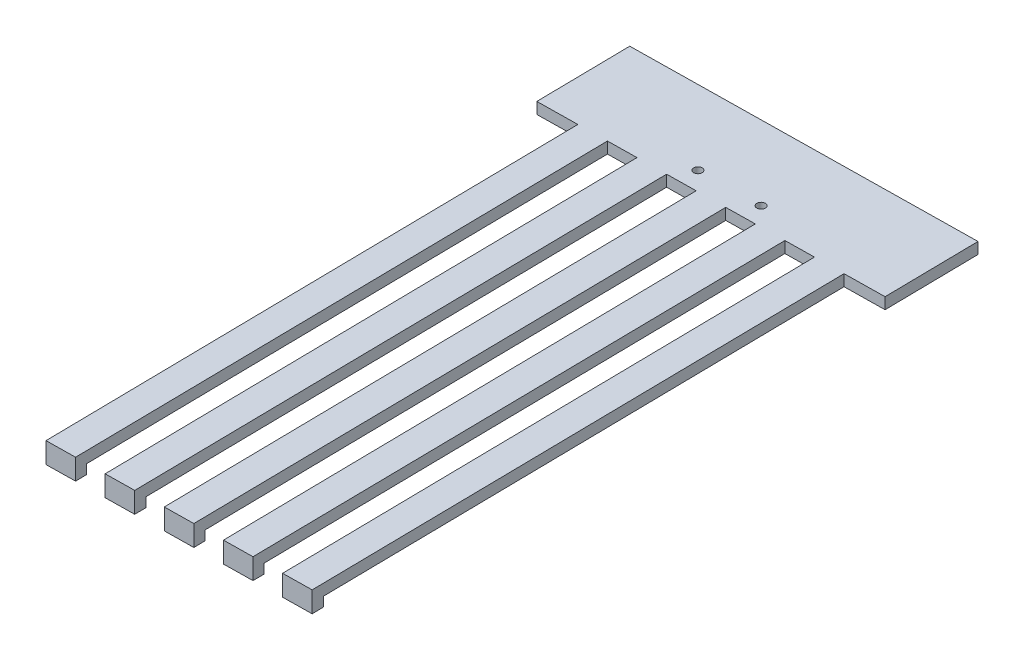
from build123d import *

# Parameters (mm, degrees)
EXTRUDE_1_DEPTH          = 30
EXTRUDE_1_DEPTH_BACK     = 20
SKETCH_1_W               = 182
SKETCH_1_H               = 6
SKETCH_2_W               = 15.454545454
SKETCH_2_H               = 6
EXTRUDE_2_DEPTH          = 286.2
EXTRUDE_3_DEPTH          = 5
PATTERN_START            = 137.957019682
PATTERN_LINEAR_1_DEPTH   = 6
PATTERN_START_2          = 132.957019682
PATTERN_LINEAR_1_2_DEPTH = 5
SKETCH_6_R               = 2.25
CUT_EXTRUDE_1_DEPTH      = 48835.841869249


# Read off the part's stored shape, not the designer's step: Линейный массив1
with BuildPart() as part:
    # Эскиз1 → Бобышка-Вытянуть1 (new, two sides: drawn at the far end of the back side and taken through both)
    with BuildSketch(Plane(origin=(-714.669316418, 0, -48802.97861783), x_dir=(0.9998927943248835, 0, -0.01464239929711995), z_dir=(0.01464239929711995, 0, 0.9998927943248835)).offset(-EXTRUDE_1_DEPTH_BACK)):
        with Locations((-531.386445276, 140.957019682)):
            Rectangle(SKETCH_1_W, SKETCH_1_H)
    extrude(amount=EXTRUDE_1_DEPTH + EXTRUDE_1_DEPTH_BACK)

    # Эскиз2 → Бобышка-Вытянуть2 (add)
    with BuildSketch(Plane(origin=(-714.23004444, 0, -48772.981834), x_dir=(0.9998927943248835, 0, -0.01464239929711995), z_dir=(0.01464239929711995, 0, 0.9998927943248835))):
        with Locations((-469.568263457, 140.957019682)):
            Rectangle(SKETCH_2_W, SKETCH_2_H)
    extrude(amount=EXTRUDE_2_DEPTH)

    # Эскиз5 → Бобышка-Вытянуть3 (add)
    with BuildSketch(Plane.XZ.offset(-137.957019682)):
        Polygon((-1187.283757155, -48479.82376444), (-1187.371611551, -48485.823121206), (-1171.918722912, -48486.049412832), (-1171.830868516, -48480.050056066), align=None)
    extrude(amount=EXTRUDE_3_DEPTH)

    # Линейный массив1 outline → Линейный массив1 (add)
    with BuildSketch(Plane(origin=(0, 0, 0), x_dir=(1, 0, 0), z_dir=(0, 1, 0)).offset(PATTERN_START)):
        Polygon((-1310.906866272, 48478.013431436), (-1295.453977632, 48478.239723062), (-1299.644632311, 48764.409040798), (-1315.097520951, 48764.182749172), align=None)
        Polygon((-1206.927300474, 48765.766790551), (-1222.380189113, 48765.540498925), (-1218.189534435, 48479.371181189), (-1202.736645795, 48479.597472815), align=None)
        Polygon((-1237.833077753, 48765.3142073), (-1253.285966393, 48765.087915674), (-1249.095311714, 48478.918597939), (-1233.642423074, 48479.144889564), align=None)
        Polygon((-1268.738855032, 48764.861624049), (-1284.191743672, 48764.635332423), (-1280.001088993, 48478.466014687), (-1264.548200353, 48478.692306313), align=None)
    extrude(amount=PATTERN_LINEAR_1_DEPTH)

    # Pattern Linear 1 2 outline → Pattern Linear 1 2 (add)
    with BuildSketch(Plane(origin=(0, 0, 0), x_dir=(1, 0, 0), z_dir=(0, 1, 0)).offset(PATTERN_START_2)):
        Polygon((-1310.994720668, 48484.012788202), (-1310.906866272, 48478.013431436), (-1295.453977632, 48478.239723062), (-1295.541832028, 48484.239079828), align=None)
        Polygon((-1264.636054749, 48484.691663079), (-1280.088943389, 48484.465371453), (-1280.001088993, 48478.466014688), (-1264.548200353, 48478.692306313), align=None)
        Polygon((-1233.73027747, 48485.14424633), (-1249.18316611, 48484.917954704), (-1249.095311714, 48478.918597939), (-1233.642423074, 48479.144889564), align=None)
        Polygon((-1202.824500191, 48485.596829581), (-1218.27738883, 48485.370537955), (-1218.189534435, 48479.371181189), (-1202.736645795, 48479.597472815), align=None)
    extrude(amount=PATTERN_LINEAR_1_2_DEPTH)

    # Эскиз6 → Вырез-Вытянуть1 (cut, through all)
    with BuildSketch(Plane.XZ.offset(-137.957019682)):
        with Locations((-1262.204177172, -48774.958389842)):
            Circle(SKETCH_6_R)
        with Locations((-1229.207714959, -48775.441589019)):
            Circle(SKETCH_6_R)
    extrude(amount=-CUT_EXTRUDE_1_DEPTH, mode=Mode.SUBTRACT)


solid = part.part
